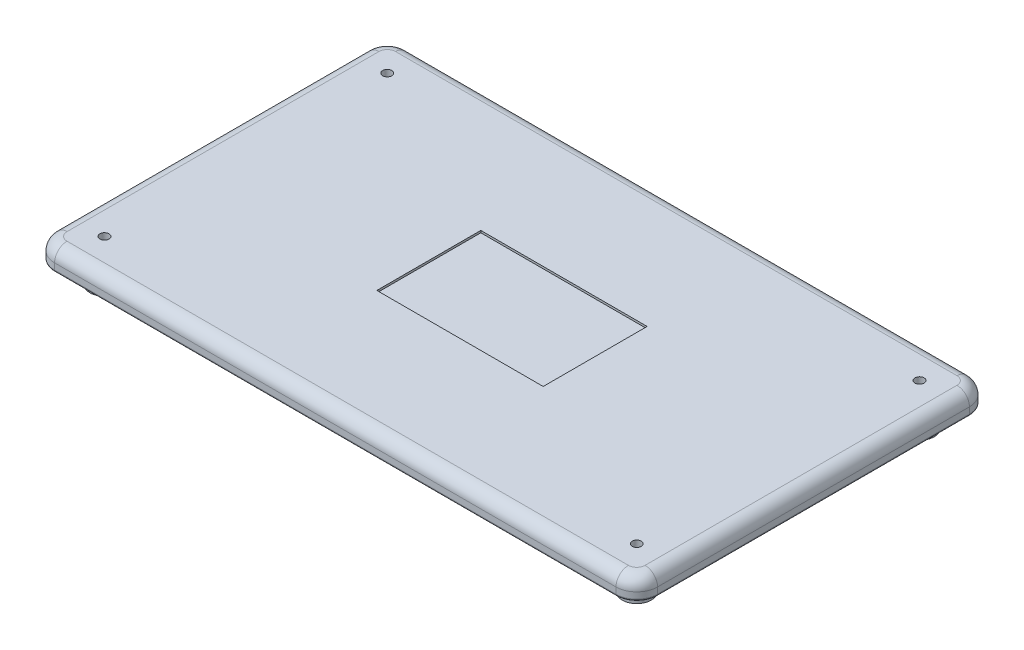
from build123d import *

# Parameters (mm, degrees)
SKETCH1_W                       = 145
SKETCH1_H                       = 85
BOSS_EXTRUDE1_DEPTH             = 5
FILLET1_R                       = 5
FILLET2_R                       = 3
SHELL1_T                        = -2
SKETCH3_R                       = 2.5
BOSS_EXTRUDE2_DEPTH             = 5
SKETCH2_W                       = 40
SKETCH2_H                       = 25
CUT_EXTRUDE1_DEPTH              = 0.5
SKETCH4_R                       = 3.5
BOSS_EXTRUDE3_DEPTH             = 3
BOSS_EXTRUDE3_DIRECTION_2_REACH = 86.33
F_2_2_2_2_DIAMETER_HOLE1_D      = 2.2
F_2_2_2_2_DIAMETER_HOLE1_DEPTH  = 4.339053319
F_2_2_2_2_DIAMETER_HOLE1_TIP    = 0.660946681
F_2_2_2_2_DIAMETER_HOLE2_D      = 2.2
FILLET3_R                       = 0.5
CUT_EXTRUDE2_START              = -2
CUT_EXTRUDE2_DEPTH              = 2


with BuildPart() as part:
    # Sketch1 → Boss-Extrude1 (new body)
    with BuildSketch(Plane(origin=(0, 0, 0), x_dir=(1, 0, 0), z_dir=(0, 1, 0))):
        Rectangle(SKETCH1_W, SKETCH1_H)
    extrude(amount=BOSS_EXTRUDE1_DEPTH)

    # Fillet1
    fillet1_edges = [part.edges().sort_by_distance(p)[0] for p in [
        (72.5, 2.5, -42.5),
        (-72.5, 2.5, -42.5),
        (72.5, 2.5, 42.5),
        (-72.5, 2.5, 42.5),
    ]]
    fillet(fillet1_edges, radius=FILLET1_R)

    # Fillet2
    fillet2_edges = [part.edges().sort_by_distance(p)[0] for p in [
        (71.035533906, 5, 41.035533906),
        (0, 5, 42.5),
        (-71.035533906, 5, 41.035533906),
        (-72.5, 5, 0),
        (-71.035533906, 5, -41.035533906),
        (0, 5, -42.5),
        (71.035533906, 5, -41.035533906),
        (72.5, 5, 0),
    ]]
    fillet(fillet2_edges, radius=FILLET2_R)

    # Shell1
    shell1_openings = [part.faces().sort_by_distance(p)[0] for p in [
        (0, 0, 0),
    ]]
    offset(amount=SHELL1_T, openings=shell1_openings, kind=Kind.INTERSECTION)

    # Sketch3 → Boss-Extrude2 (add)
    with BuildSketch(Plane.XZ.offset(-3)):
        with Locations((-60, 25)):
            Circle(SKETCH3_R)
        with Locations((-60, -25)):
            Circle(SKETCH3_R)
        with Locations((60, -25)):
            Circle(SKETCH3_R)
        with Locations((60, 25)):
            Circle(SKETCH3_R)
        with Locations((-20, -25)):
            Circle(SKETCH3_R)
        with Locations((20, -25)):
            Circle(SKETCH3_R)
        with Locations((20, 25)):
            Circle(SKETCH3_R)
        with Locations((-20, 25)):
            Circle(SKETCH3_R)
    extrude(amount=BOSS_EXTRUDE2_DEPTH)

    # Sketch2 → Cut-Extrude1 (cut)
    with BuildSketch(Plane.XZ.offset(-5)):
        Rectangle(SKETCH2_W, SKETCH2_H)
    extrude(amount=CUT_EXTRUDE1_DEPTH, mode=Mode.SUBTRACT)

    # Sketch4 → Boss-Extrude3 (add)
    with BuildSketch(Plane.XZ.offset(2)):
        with Locations((-64, 34)):
            Circle(SKETCH4_R)
        with Locations((-64, -34)):
            Circle(SKETCH4_R)
        with Locations((64, 34)):
            Circle(SKETCH4_R)
        with Locations((64, -34)):
            Circle(SKETCH4_R)
    extrude(amount=BOSS_EXTRUDE3_DEPTH)

    # Sketch4 → Boss-Extrude3 direction 2 (add, up to next)
    with BuildSketch(Plane.XZ.offset(2), mode=Mode.PRIVATE) as boss_extrude3_direction_2_sk1:
        with Locations((-64, 34)):
            Circle(SKETCH4_R)
    boss_extrude3_direction_2_tool1 = extrude(boss_extrude3_direction_2_sk1.sketch, amount=-BOSS_EXTRUDE3_DIRECTION_2_REACH, mode=Mode.PRIVATE) - part.part
    # Sketch4 → Boss-Extrude3 direction 2 (add, up to next)
    with BuildSketch(Plane.XZ.offset(2), mode=Mode.PRIVATE) as boss_extrude3_direction_2_sk2:
        with Locations((-64, -34)):
            Circle(SKETCH4_R)
    boss_extrude3_direction_2_tool2 = extrude(boss_extrude3_direction_2_sk2.sketch, amount=-BOSS_EXTRUDE3_DIRECTION_2_REACH, mode=Mode.PRIVATE) - part.part
    # Sketch4 → Boss-Extrude3 direction 2 (add, up to next)
    with BuildSketch(Plane.XZ.offset(2), mode=Mode.PRIVATE) as boss_extrude3_direction_2_sk3:
        with Locations((64, 34)):
            Circle(SKETCH4_R)
    boss_extrude3_direction_2_tool3 = extrude(boss_extrude3_direction_2_sk3.sketch, amount=-BOSS_EXTRUDE3_DIRECTION_2_REACH, mode=Mode.PRIVATE) - part.part
    # Sketch4 → Boss-Extrude3 direction 2 (add, up to next)
    with BuildSketch(Plane.XZ.offset(2), mode=Mode.PRIVATE) as boss_extrude3_direction_2_sk4:
        with Locations((64, -34)):
            Circle(SKETCH4_R)
    boss_extrude3_direction_2_tool4 = extrude(boss_extrude3_direction_2_sk4.sketch, amount=-BOSS_EXTRUDE3_DIRECTION_2_REACH, mode=Mode.PRIVATE) - part.part
    add(boss_extrude3_direction_2_tool1.solids().sort_by_distance((-64, -2, 34))[0])
    add(boss_extrude3_direction_2_tool2.solids().sort_by_distance((-64, -2, -34))[0])
    add(boss_extrude3_direction_2_tool3.solids().sort_by_distance((64, -2, 34))[0])
    add(boss_extrude3_direction_2_tool4.solids().sort_by_distance((64, -2, -34))[0])

    # Ø2.2 (2.2) Diameter Hole1
    with Locations(Plane(origin=(0, -2, 0), x_dir=(-1, 0, 0), z_dir=(0, -1, 0))):
        with Locations((-60, -25), (-60, 25), (-20, 25), (-20, -25), (20, -25), (20, 25), (60, 25), (60, -25)):
            Hole(F_2_2_2_2_DIAMETER_HOLE1_D / 2, depth=F_2_2_2_2_DIAMETER_HOLE1_DEPTH)
            with Locations((0, 0, -(F_2_2_2_2_DIAMETER_HOLE1_DEPTH + F_2_2_2_2_DIAMETER_HOLE1_TIP / 2))):  # 118° drill point
                Cone(0, F_2_2_2_2_DIAMETER_HOLE1_D / 2, F_2_2_2_2_DIAMETER_HOLE1_TIP, mode=Mode.SUBTRACT)

    # Ø2.2 (2.2) Diameter Hole2 (through all)
    with Locations(Plane(origin=(0, -5, 0), x_dir=(-1, 0, 0), z_dir=(0, -1, 0))):
        with Locations((-64, -34), (-64, 34), (64, 34), (64, -34)):
            Hole(F_2_2_2_2_DIAMETER_HOLE2_D / 2)

    # Fillet3
    fillet3_edges = [part.edges().sort_by_distance(p)[0] for p in [
        (71.035533906, 0, -41.035533906),
        (72.5, 0, 0),
        (71.035533906, 0, 41.035533906),
        (0, 0, 42.5),
        (-71.035533906, 0, 41.035533906),
        (-72.5, 0, 0),
        (-71.035533906, 0, -41.035533906),
        (0, 0, -42.5),
    ]]
    fillet(fillet3_edges, radius=FILLET3_R)

    # Sketch10 → Cut-Extrude2 (cut)
    with BuildSketch(Plane.XZ.offset(CUT_EXTRUDE2_START)):
        with BuildLine():
            Line((-67.5, -40.7), (67.5, -40.7))
            ThreePointArc((67.5, -40.7), (69.7627417, -39.7627417), (70.7, -37.5))
            Line((70.7, -37.5), (70.7, 37.5))
            ThreePointArc((70.7, 37.5), (69.7627417, 39.7627417), (67.5, 40.7))
            Line((67.5, 40.7), (-67.5, 40.7))
            ThreePointArc((-67.5, 40.7), (-69.7627417, 39.7627417), (-70.7, 37.5))
            Line((-70.7, 37.5), (-70.7, -37.5))
            ThreePointArc((-70.7, -37.5), (-69.7627417, -39.7627417), (-67.5, -40.7))
        make_face()
        with BuildLine():
            Line((70.5, 37.5), (70.5, -37.5))
            ThreePointArc((70.5, -37.5), (69.621320344, -39.621320344), (67.5, -40.5))
            Line((67.5, -40.5), (-67.5, -40.5))
            ThreePointArc((-67.5, -40.5), (-69.621320344, -39.621320344), (-70.5, -37.5))
            Line((-70.5, -37.5), (-70.5, 37.5))
            ThreePointArc((-70.5, 37.5), (-69.621320344, 39.621320344), (-67.5, 40.5))
            Line((-67.5, 40.5), (67.5, 40.5))
            ThreePointArc((67.5, 40.5), (69.621320344, 39.621320344), (70.5, 37.5))
        make_face(mode=Mode.SUBTRACT)
    extrude(amount=CUT_EXTRUDE2_DEPTH, mode=Mode.SUBTRACT)


solid = part.part
